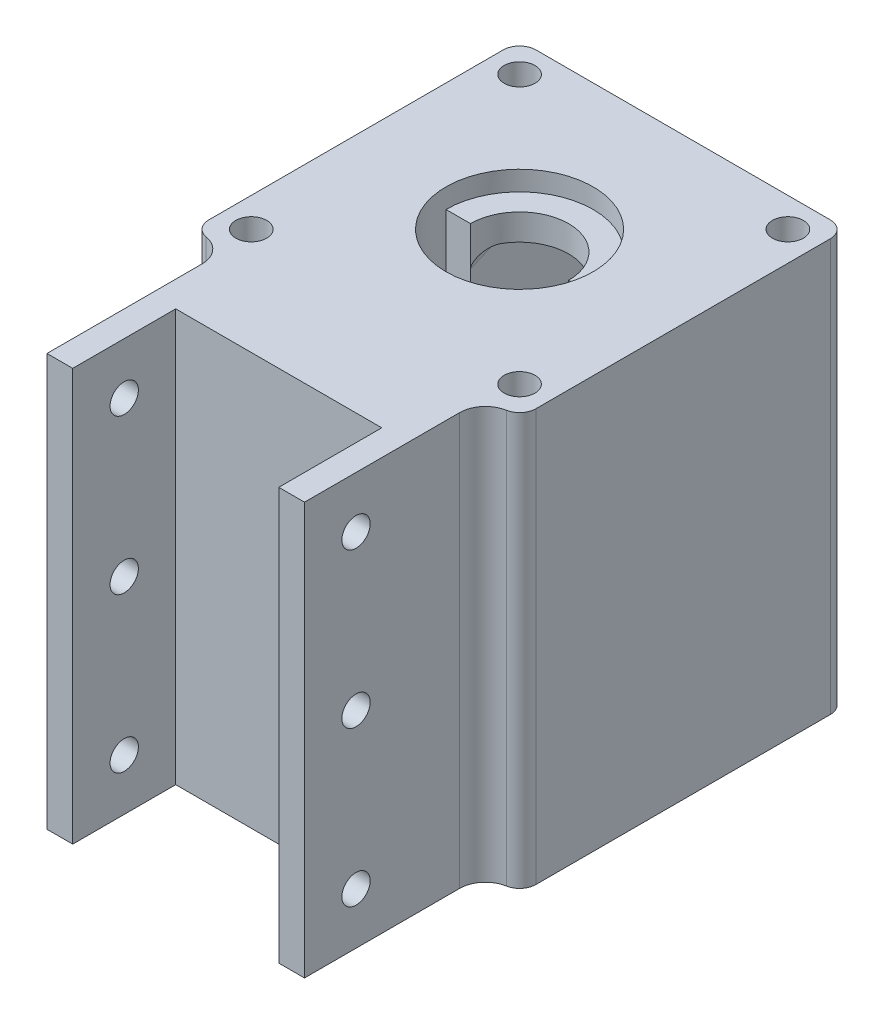
from build123d import *
from build123d.topology import SkipClean

# Parameters (mm, degrees)
SKETCH2_W                      = 63.5
SKETCH2_H                      = 63.5
BOSS_EXTRUDE1_DEPTH            = 80
CUT_EXTRUDE1_REACH             = 93.739
SKETCH4_R                      = 14.2875
CUT_EXTRUDE2_DEPTH             = 3.81
CUT_EXTRUDE3_DEPTH             = 62.22
CUT_EXTRUDE4_REACH             = 93.739
CUT_EXTRUDE4_DIRECTION_2_REACH = 93.739
FILLET2_R                      = 2.54
SKETCH9_W                      = 5
SKETCH9_H                      = 80
BOSS_EXTRUDE2_DEPTH            = 35
SKETCH10_R                     = 2.75
CUT_EXTRUDE6_DEPTH             = 119.642846392
CUT_EXTRUDE7_REACH             = 110.92
SKETCH11_R                     = 3
SKETCH12_W                     = 40
SKETCH12_H                     = 80
BOSS_EXTRUDE3_DEPTH            = 15
SKETCH13_R                     = 3
CUT_EXTRUDE8_DEPTH             = 10
FILLET3_R                      = 3.175
FILLET4_DEPTH                  = 80


with BuildPart() as part:
    # Sketch2 → Boss-Extrude1 (new body)
    with BuildSketch(Plane(origin=(0, 0, 0), x_dir=(1, 0, 0), z_dir=(0, 1, 0))):
        Rectangle(SKETCH2_W, SKETCH2_H)
    extrude(amount=BOSS_EXTRUDE1_DEPTH)

    # Sketch3 → Cut-Extrude1 (cut, up to next)
    with BuildSketch(Plane(origin=(0, 80, 0), x_dir=(1, 0, 0), z_dir=(0, 1, 0)), mode=Mode.PRIVATE) as cut_extrude1_sk1:
        with BuildLine():
            Line((9.525, 0), (14.2875, 0))
            ThreePointArc((14.2875, 0), (0, -14.2875), (-14.2875, 0))
            Line((-14.2875, 0), (-9.525, 0))
            ThreePointArc((-9.525, 0), (0, 9.525), (9.525, 0))
        make_face()
    cut_extrude1_tool1 = extrude(cut_extrude1_sk1.sketch, amount=-CUT_EXTRUDE1_REACH, mode=Mode.PRIVATE) & part.part
    add(cut_extrude1_tool1.solids().sort_by_distance((0, 80, 2.954161))[0], mode=Mode.SUBTRACT)

    # Sketch4 → Cut-Extrude2 (cut)
    with BuildSketch(Plane(origin=(0, 80, 0), x_dir=(1, 0, 0), z_dir=(0, 1, 0))):
        with Locations(Location((0, 0, 0), (0, 0, 270))):
            Circle(SKETCH4_R)
    extrude(amount=-CUT_EXTRUDE2_DEPTH, mode=Mode.SUBTRACT)

    # Sketch6 → Cut-Extrude3 (cut)
    with BuildSketch(Plane(origin=(0, 71.11, 0), x_dir=(1, 0, 0), z_dir=(0, 1, 0))):
        with BuildLine():
            Line((9.525, 0), (19.05, 31.75))
            Line((19.05, 31.75), (-19.05, 31.75))
            Line((-19.05, 31.75), (-9.525, 0))
            ThreePointArc((-9.525, 0), (0, 9.525), (9.525, 0))
        make_face()
    extrude(amount=-CUT_EXTRUDE3_DEPTH, mode=Mode.SUBTRACT)

    # Cut-Extrude4: up to this plane
    with SkipClean():  # the faces are left unmerged after this step: merging them gives an invalid solid
        cut_extrude4_end = Plane(origin=(-9.525, -49.595085442, 0), z_dir=(-0.9578262852211514, 0, 0.2873478855663456))
        # Sketch7 → Cut-Extrude4 (cut, up to the surface)
        with BuildSketch(Plane(origin=(0, 0, 0), x_dir=(0, 0, -1), z_dir=(1, 0, 0)), mode=Mode.PRIVATE) as cut_extrude4_sk1:
            Polygon((0, 8.89), (31.75, 8.89), (0, 0), align=None)
        cut_extrude4_tool1 = split(extrude(cut_extrude4_sk1.sketch, amount=-CUT_EXTRUDE4_REACH, mode=Mode.PRIVATE), bisect_by=cut_extrude4_end, keep=Keep.BOTH, mode=Mode.PRIVATE)
        add(cut_extrude4_tool1.solids().sort_by_distance((0, 5.926667, -10.583333))[0], mode=Mode.SUBTRACT)

    # Cut-Extrude4 direction 2: up to this plane
    cut_extrude4_direction_2_end = Plane(origin=(9.525, -49.595085442, 0), z_dir=(0.9578262852211514, 0, 0.2873478855663456))
    # Sketch7 → Cut-Extrude4 direction 2 (cut, up to the surface)
    with BuildSketch(Plane(origin=(0, 0, 0), x_dir=(0, 0, -1), z_dir=(1, 0, 0)), mode=Mode.PRIVATE) as cut_extrude4_direction_2_sk1:
        Polygon((0, 8.89), (31.75, 8.89), (0, 0), align=None)
    cut_extrude4_direction_2_tool1 = split(extrude(cut_extrude4_direction_2_sk1.sketch, amount=CUT_EXTRUDE4_DIRECTION_2_REACH, mode=Mode.PRIVATE), bisect_by=cut_extrude4_direction_2_end, keep=Keep.BOTH, mode=Mode.PRIVATE)
    add(cut_extrude4_direction_2_tool1.solids().sort_by_distance((0, 5.926667, -10.583333))[0], mode=Mode.SUBTRACT)

    # Fillet2
    # the kernel refuses this fillet: 2.54 mm, written as the material it adds along each edge
    with BuildSketch(Plane(origin=(7.700340927, 71.11, 6.082196911), x_dir=(-0.9578262852211513, 0, -0.2873478855663455), z_dir=(0.28734788556634555, 0, -0.9578262852211513))) as fillet2_piece_1_section:
        with BuildLine():
            CenterArc((FILLET2_R, -FILLET2_R), FILLET2_R, 90, 90)
            Line((0, -FILLET2_R), (0, 0))
            Line((0, 0), (FILLET2_R, 0))
        make_face()
    fillet2_piece_1 = extrude(amount=45.847973166, mode=Mode.PRIVATE)
    fillet2_piece_1 = split(fillet2_piece_1, bisect_by=Plane(origin=(7.700340927, 71.11, -31.75), z_dir=(0, 0, 1)), keep=Keep.TOP, mode=Mode.PRIVATE)
    fillet2_piece_1 = fillet2_piece_1 - Plane(origin=(0, 71.11, 0), x_dir=(-1, 0, 0), z_dir=(0, 1, 0)) * Cylinder(9.525, 102, mode=Mode.PRIVATE)
    fillet2_piece_1 = split(fillet2_piece_1, bisect_by=Plane(origin=(7.700340927, 71.11, 0), z_dir=(0, 0, -1)), keep=Keep.TOP, mode=Mode.PRIVATE)
    add(fillet2_piece_1)
    with BuildSketch(Plane(origin=(-20.874659073, 71.11, -37.832196911), x_dir=(0, -1, 0), z_dir=(0.28734788556634555, 0, 0.9578262852211513))) as fillet2_piece_2_section:
        with BuildLine():
            CenterArc((FILLET2_R, FILLET2_R), FILLET2_R, 180, 90)
            Line((0, FILLET2_R), (0, 0))
            Line((0, 0), (FILLET2_R, 0))
        make_face()
    fillet2_piece_2 = extrude(amount=45.847973166, mode=Mode.PRIVATE)
    fillet2_piece_2 = split(fillet2_piece_2, bisect_by=Plane(origin=(-20.874659073, 71.11, -31.75), z_dir=(0, 0, 1)), keep=Keep.TOP, mode=Mode.PRIVATE)
    fillet2_piece_2 = split(fillet2_piece_2, bisect_by=Plane(origin=(-20.874659073, 71.11, 0), z_dir=(0, 0, -1)), keep=Keep.TOP, mode=Mode.PRIVATE)
    fillet2_piece_2 = fillet2_piece_2 - Plane(origin=(0, 71.11, 0), x_dir=(-1, 0, 0), z_dir=(0, 1, 0)) * Cylinder(9.525, 102, mode=Mode.PRIVATE)
    add(fillet2_piece_2)
    with BuildSketch(Plane(origin=(-20.954648619, 10.667672044, -38.098828729), x_dir=(0.9607141016314922, 0.07483307171461691, -0.2672609704093551), z_dir=(0.2775399339309484, -0.2590372716688848, 0.9251331131031606))) as fillet2_piece_3_section:
        with BuildLine():
            CenterArc((FILLET2_R * 1.08072615035, FILLET2_R), FILLET2_R, 175.556407911, 94.443592089)
            Line((FILLET2_R * 0.0837320564804, FILLET2_R * 1.07747758898), (0, 0))
            Line((0, 0), (FILLET2_R * 1.08072615035, 0))
        make_face()
    fillet2_piece_3 = extrude(amount=52.848435405, mode=Mode.PRIVATE)
    fillet2_piece_3 = split(fillet2_piece_3, bisect_by=Plane(origin=(-20.954648619, 10.667672044, -31.75), z_dir=(0, 0, 1)), keep=Keep.TOP, mode=Mode.PRIVATE)
    fillet2_piece_3 = fillet2_piece_3 - Plane(origin=(0, 10.667672044, 0), x_dir=(-1, 0, 0), z_dir=(0, 1, 0)) * Cylinder(9.525, 117, mode=Mode.PRIVATE)
    fillet2_piece_3 = split(fillet2_piece_3, bisect_by=Plane(origin=(-20.954648619, 10.667672044, 0), z_dir=(0, 0, -1)), keep=Keep.TOP, mode=Mode.PRIVATE)
    add(fillet2_piece_3)
    with BuildSketch(Plane(origin=(20.954648619, 10.667672044, -38.098828729), x_dir=(-0.9607141016314922, 0.07483307171461691, -0.2672609704093551), z_dir=(-0.2775399339309484, -0.2590372716688848, 0.9251331131031606))) as fillet2_piece_4_section:
        with BuildLine():
            CenterArc((FILLET2_R * 1.08072615035, -FILLET2_R), FILLET2_R, 90, 94.443592089)
            Line((FILLET2_R * 0.0837320564804, -FILLET2_R * 1.07747758898), (0, 0))
            Line((0, 0), (FILLET2_R * 1.08072615035, 0))
        make_face()
    fillet2_piece_4 = extrude(amount=52.848435405, mode=Mode.PRIVATE)
    fillet2_piece_4 = split(fillet2_piece_4, bisect_by=Plane(origin=(20.954648619, 10.667672044, -31.75), z_dir=(0, 0, 1)), keep=Keep.TOP, mode=Mode.PRIVATE)
    fillet2_piece_4 = fillet2_piece_4 - Plane(origin=(0, 10.667672044, 0), x_dir=(-1, 0, 0), z_dir=(0, 1, 0)) * Cylinder(9.525, 117, mode=Mode.PRIVATE)
    fillet2_piece_4 = split(fillet2_piece_4, bisect_by=Plane(origin=(20.954648619, 10.667672044, 0), z_dir=(0, 0, -1)), keep=Keep.TOP, mode=Mode.PRIVATE)
    add(fillet2_piece_4)

    # Sketch9 → Boss-Extrude2 (add)
    with BuildSketch(Plane.XY.offset(31.75)):
        with Locations((-22.5, 40)):
            Rectangle(SKETCH9_W, SKETCH9_H)
        with Locations((22.5, 40)):
            Rectangle(SKETCH9_W, SKETCH9_H)
    extrude(amount=BOSS_EXTRUDE2_DEPTH)

    # Sketch10 → Cut-Extrude6 (cut, through all)
    with BuildSketch(Plane.ZY.offset(25)):
        with Locations(Location((56.75, 70, 0), (0, 0, 270))):
            Circle(SKETCH10_R)
        with Locations(Location((56.75, 10, 0), (0, 0, 270))):
            Circle(SKETCH10_R)
        with Locations(Location((56.75, 40, 0), (0, 0, 270))):
            Circle(SKETCH10_R)
    extrude(amount=-CUT_EXTRUDE6_DEPTH, mode=Mode.SUBTRACT)

    # Sketch11 → Cut-Extrude7 (cut, up to next)
    with BuildSketch(Plane.XZ, mode=Mode.PRIVATE) as cut_extrude7_sk1:
        with Locations(Location((26.042742751, -26.042742751, 0), (0, 0, 270))):
            Circle(SKETCH11_R)
    cut_extrude7_tool1 = extrude(cut_extrude7_sk1.sketch, amount=-CUT_EXTRUDE7_REACH, mode=Mode.PRIVATE) & part.part
    # Sketch11 → Cut-Extrude7 (cut, up to next)
    with BuildSketch(Plane.XZ, mode=Mode.PRIVATE) as cut_extrude7_sk2:
        with Locations(Location((26.042742751, 26.042742751, 0), (0, 0, 270))):
            Circle(SKETCH11_R)
    cut_extrude7_tool2 = extrude(cut_extrude7_sk2.sketch, amount=-CUT_EXTRUDE7_REACH, mode=Mode.PRIVATE) & part.part
    # Sketch11 → Cut-Extrude7 (cut, up to next)
    with BuildSketch(Plane.XZ, mode=Mode.PRIVATE) as cut_extrude7_sk3:
        with Locations(Location((-26.042742751, -26.042742751, 0), (0, 0, 270))):
            Circle(SKETCH11_R)
    cut_extrude7_tool3 = extrude(cut_extrude7_sk3.sketch, amount=-CUT_EXTRUDE7_REACH, mode=Mode.PRIVATE) & part.part
    # Sketch11 → Cut-Extrude7 (cut, up to next)
    with BuildSketch(Plane.XZ, mode=Mode.PRIVATE) as cut_extrude7_sk4:
        with Locations(Location((-26.042742751, 26.042742751, 0), (0, 0, 270))):
            Circle(SKETCH11_R)
    cut_extrude7_tool4 = extrude(cut_extrude7_sk4.sketch, amount=-CUT_EXTRUDE7_REACH, mode=Mode.PRIVATE) & part.part
    add(cut_extrude7_tool1.solids().sort_by_distance((26.042743, 0, -26.042743))[0], mode=Mode.SUBTRACT)
    add(cut_extrude7_tool2.solids().sort_by_distance((26.042743, 0, 26.042743))[0], mode=Mode.SUBTRACT)
    add(cut_extrude7_tool3.solids().sort_by_distance((-26.042743, 0, -26.042743))[0], mode=Mode.SUBTRACT)
    add(cut_extrude7_tool4.solids().sort_by_distance((-26.042743, 0, 26.042743))[0], mode=Mode.SUBTRACT)

    # Sketch12 → Boss-Extrude3 (add)
    with BuildSketch(Plane.XY.offset(31.75)):
        with Locations((0, 40)):
            Rectangle(SKETCH12_W, SKETCH12_H)
    extrude(amount=BOSS_EXTRUDE3_DEPTH)

    # Sketch13 → Cut-Extrude8 (cut)
    with BuildSketch(Plane(origin=(0, 0, -31.75), x_dir=(-1, 0, 0), z_dir=(0, 0, -1))):
        with Locations((-18.75, 75)):
            Circle(SKETCH13_R)
        with Locations(Location((18.75, 75, 0), (0, 0, 180))):
            Circle(SKETCH13_R)
        with Locations((18.75, 5)):
            Circle(SKETCH13_R)
        with Locations(Location((-18.75, 5, 0), (0, 0, 180))):
            Circle(SKETCH13_R)
    extrude(amount=-CUT_EXTRUDE8_DEPTH, mode=Mode.SUBTRACT)

    # Fillet3
    fillet3_edges = [part.edges().sort_by_distance(p)[0] for p in [
        (31.75, 40, 31.75),
        (-31.75, 40, 31.75),
        (-31.75, 40, -31.75),
        (31.75, 40, -31.75),
    ]]
    fillet(fillet3_edges, radius=FILLET3_R)

    # Fillet4: read off the stored shape, not the designer's step
    # Fillet4 outline → Fillet4 (add)
    with BuildSketch(Plane(origin=(0, 0, 0), x_dir=(1, 0, 0), z_dir=(0, 1, 0))):
        with BuildLine():
            Line((25, -31.75), (25, -36.624844719))
            ThreePointArc((25, -36.624844719), (26.168694859, -33.412197692), (29.128440367, -31.701392291))
            ThreePointArc((29.128440367, -31.701392291), (28.852785416, -31.737824728), (28.575, -31.75))
            Line((28.575, -31.75), (25, -31.75))
        make_face()
        with BuildLine():
            ThreePointArc((-28.575, -31.75), (-28.852785416, -31.737824728), (-29.128440367, -31.701392291))
            ThreePointArc((-29.128440367, -31.701392291), (-26.168694859, -33.412197692), (-25, -36.624844719))
            Line((-25, -36.624844719), (-25, -31.75))
            Line((-25, -31.75), (-28.575, -31.75))
        make_face()
    extrude(amount=FILLET4_DEPTH)


solid = part.part
